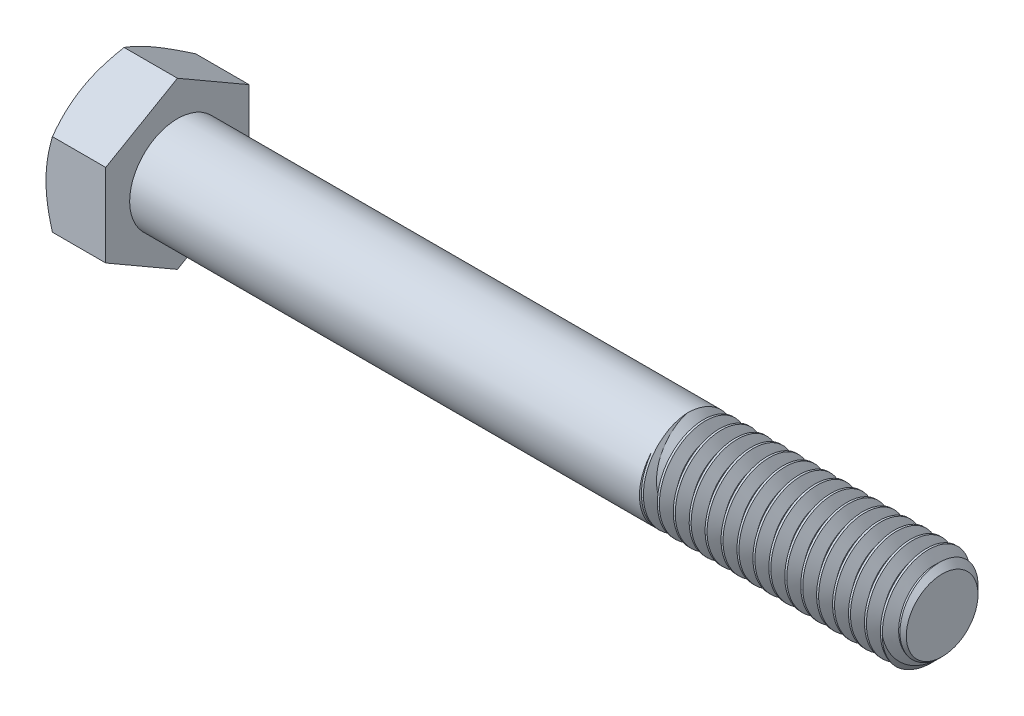
from build123d import *

# Parameters (mm, degrees)
SKETCH5_R           = 4.7625
BOSS_EXTRUDE3_DEPTH = 76.2
CHAMFER1_SIZE       = 1.190625
CUT_SWEEP1_PITCH    = 1.5875
BOSS_EXTRUDE4_DEPTH = 5.953125
SKETCH8_OUTSIDE_W   = 323.838
SKETCH8_OUTSIDE_H   = 326.048
SKETCH8_OUTSIDE_R   = 7.14375
CUT_EXTRUDE3_DEPTH  = 83.874684594
CUT_EXTRUDE3_DRAFT  = -60


with BuildPart() as part:
    # Sketch5 → Boss-Extrude3 (new body)
    with BuildSketch(Plane(origin=(41.0765625, 0, 0), x_dir=(0, 0, -1), z_dir=(1, 0, 0))):
        Circle(SKETCH5_R)
    extrude(amount=-BOSS_EXTRUDE3_DEPTH)

    # Chamfer1
    chamfer1_edges = [part.edges().sort_by_distance(p)[0] for p in [
        (41.0765625, 0, 4.7625),
    ]]
    chamfer(chamfer1_edges, length=CHAMFER1_SIZE)

    # Cut-Sweep1: the profile of Sketch10 profile screwed along a right-hand helix of 17 turns, 8 arcs to a turn; built about Z, then put on its axis
    cut_sweep1_z = Axis((0, 0, 0), (0, 0, 1))
    cut_sweep1_corners = [(4.7628, 0, 0.000173205), (3.731388504, 0, -0.5953125), (3.731388504, 0, -0.79375), (4.7628, 0, -1.389235705)]
    with BuildLine(mode=Mode.PRIVATE) as cut_sweep1_profile:
        Line(cut_sweep1_corners[0], cut_sweep1_corners[1])
        Line(cut_sweep1_corners[1], cut_sweep1_corners[2])
        Line(cut_sweep1_corners[2], cut_sweep1_corners[3])
        Line(cut_sweep1_corners[3], cut_sweep1_corners[0])
    cut_sweep1_cap = Face(cut_sweep1_profile.wire())
    cut_sweep1_turn_angles = [0, 22.5, 45, 67.5, 90, 112.5, 135, 157.5, 180, 202.5, 225, 247.5, 270, 292.5, 315, 337.5, 360]
    cut_sweep1_turn_weights = [1, 0.9238795325112867, 1, 0.9238795325112867, 1, 0.9238795325112867, 1, 0.9238795325112867, 1, 0.9238795325112867, 1, 0.9238795325112867, 1, 0.9238795325112867, 1, 0.9238795325112867, 1]
    cut_sweep1_turn_rails = [Edge.make_bspline([Vector(p[0], p[1], 0).rotate(cut_sweep1_z, cut_sweep1_turn_angles[k]) / cut_sweep1_turn_weights[k] + Vector(0, 0, p[2] + CUT_SWEEP1_PITCH * cut_sweep1_turn_angles[k] / 360) for k in range(17)], [0, 0, 0, 1, 1, 2, 2, 3, 3, 4, 4, 5, 5, 6, 6, 7, 7, 8, 8, 8], 2, cut_sweep1_turn_weights) for p in cut_sweep1_corners]
    cut_sweep1_turn_sides = [Face.make_surface_from_curves(cut_sweep1_turn_rails[p[0]], cut_sweep1_turn_rails[p[1]]) for p in [(0, 1), (1, 2), (2, 3), (3, 0)]]
    cut_sweep1 = Plane(origin=(41.0765625, 0, 0), x_dir=(0, 1, 0), z_dir=(-1, 0, 0)) * Solid(Shell([*[p.moved(Location((0, 0, CUT_SWEEP1_PITCH * i))) for i in range(17) for p in cut_sweep1_turn_sides], cut_sweep1_cap, cut_sweep1_cap.rotate(cut_sweep1_z, 6120).moved(Location((0, 0, CUT_SWEEP1_PITCH * 6120 / 360)))]))
    add(cut_sweep1, mode=Mode.SUBTRACT)

    # Sketch11 → Revolve1 (revolve)
    with BuildSketch(Plane.XY, mode=Mode.PRIVATE) as revolve1_sk:
        Polygon((-35.1234375, 4.7625), (-35.1234375, 0), (20.4390625, 0), (15.6765625, 4.7625), align=None)
    revolve(revolve1_sk.sketch.rotate(Axis((-35.1234375, 0, 0), (1, 0, 0)), 270), axis=Axis((-35.1234375, 0, 0), (1, 0, 0)))

    # Sketch6 → Boss-Extrude4 (add)
    with BuildSketch(Plane.ZY.offset(35.1234375)):
        Polygon((7.14375, 4.124445986), (0, 8.248891971), (-7.14375, 4.124445986), (-7.14375, -4.124445986), (0, -8.248891971), (7.14375, -4.124445986), align=None)
    extrude(amount=BOSS_EXTRUDE4_DEPTH)


with BuildPart() as cut_extrude3_tool:
    # Sketch8 outside → Cut-Extrude3 (with draft: the straight prism first)
    with BuildSketch(Plane.ZY.offset(41.0765625)):
        Rectangle(SKETCH8_OUTSIDE_W, SKETCH8_OUTSIDE_H)
        Circle(SKETCH8_OUTSIDE_R, mode=Mode.SUBTRACT)
    extrude(amount=-CUT_EXTRUDE3_DEPTH)
    # Cut-Extrude3: the draft: its side faces are tilted about the plane it starts from
    cut_extrude3_sides = [cut_extrude3_tool.faces().sort_by_distance(p)[0] for p in [
        (0.860779797, -163.024, 0),
        (0.860779797, 0, 161.919),
        (0.860779797, 163.024, 0),
        (0.860779797, 0, -161.919),
        (0.860779797, 0, -7.14375),
    ]]
    draft(cut_extrude3_sides, Plane.ZY.offset(41.0765625), CUT_EXTRUDE3_DRAFT)


with BuildPart() as part_1:
    add(part.part)

    # Cut-Extrude3: cut by cut_extrude3_tool
    add(cut_extrude3_tool.part, mode=Mode.SUBTRACT)


solid = part_1.part
